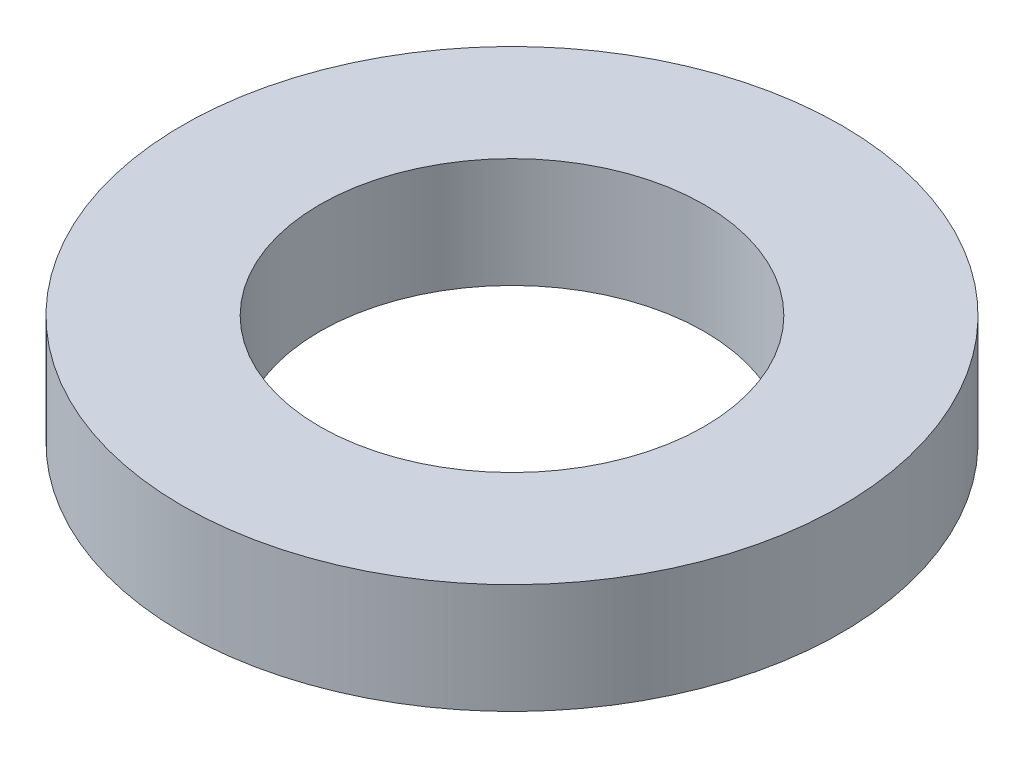
from build123d import *

# Parameters (mm, degrees)
SKETCH1_R           = 60
BOSS_EXTRUDE1_DEPTH = 20
SKETCH2_R           = 35
CUT_EXTRUDE1_DEPTH  = 88.177978871


with BuildPart() as part:
    # Sketch1 → Boss-Extrude1 (new body)
    with BuildSketch(Plane(origin=(0, 0, 0), x_dir=(1, 0, 0), z_dir=(0, 1, 0))):
        Circle(SKETCH1_R)
    extrude(amount=BOSS_EXTRUDE1_DEPTH)

    # Sketch2 → Cut-Extrude1 (cut, through all)
    with BuildSketch(Plane(origin=(0, 0, 0), x_dir=(1, 0, 0), z_dir=(0, 1, 0))):
        Circle(SKETCH2_R)
    extrude(amount=CUT_EXTRUDE1_DEPTH, mode=Mode.SUBTRACT)


solid = part.part
